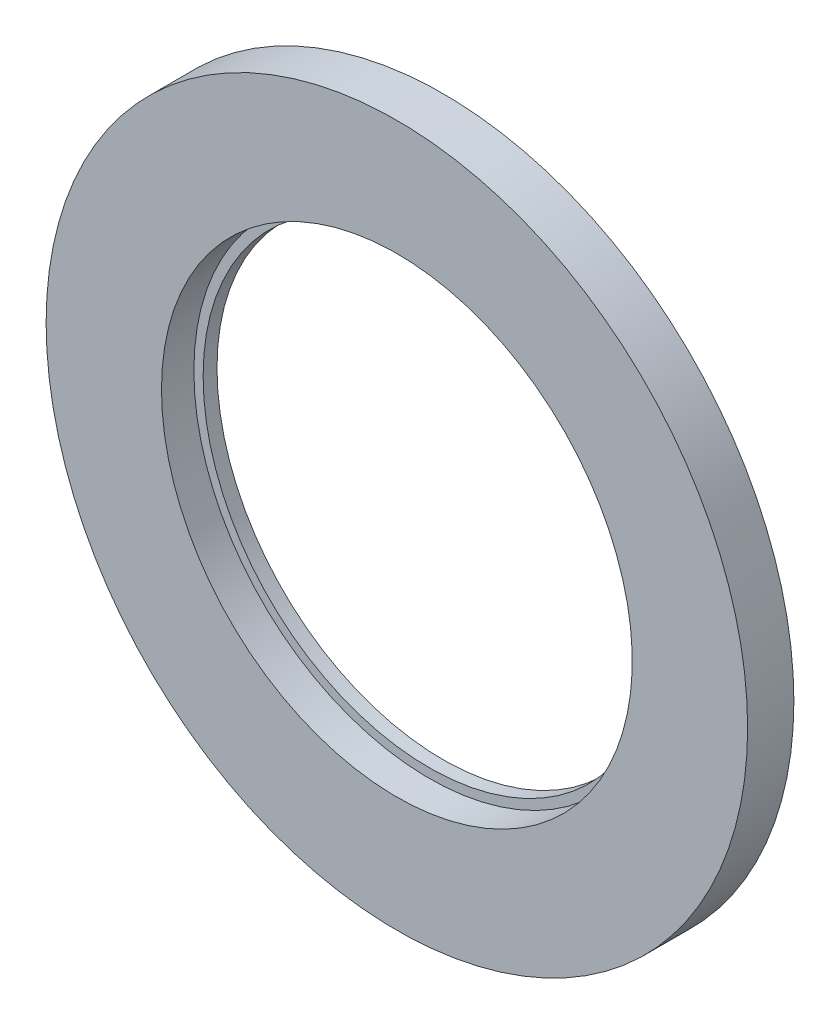
from build123d import *


with BuildPart() as part:
    # Sketch1 → Revolve1 (revolve)
    with BuildSketch(Plane.XZ):
        Polygon((48.9, 0), (75.85, 0), (75.85, 10), (50.9, 10), (50.9, 3), (48.9, 3), align=None)
    revolve(axis=Axis((0, 0, 10), (0, 0, -1)))


solid = part.part
